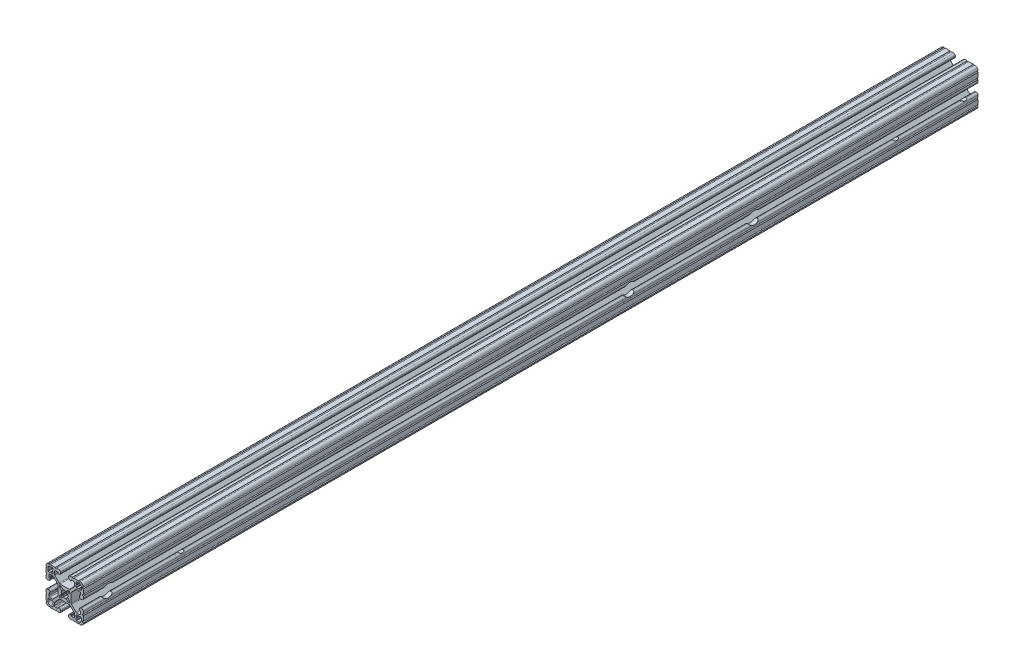
from build123d import *

# Parameters (mm, degrees)
BOSS_EXTRUDE1_DEPTH = 914.4
SKETCH3_R           = 4.7625
SKETCH3_R_2         = 6.35
CUT_EXTRUDE1_DEPTH  = 2323.966592157


with BuildPart() as part:
    # Sketch1 → Boss-Extrude1 (new body)
    with BuildSketch(Plane(origin=(0, 0, -2322.576), x_dir=(-1, 0, 0), z_dir=(0, 0, -1))):
        with BuildLine():
            Line((19.05, -14.325600033), (19.05, -9.4996))
            ThreePointArc((19.05, -9.4996), (18.288, -8.7376), (19.05, -7.9756))
            Line((19.05, -7.9756), (19.05, -5.6388))
            ThreePointArc((19.05, -5.6388), (18.588751759, -4.525248241), (17.4752, -4.064))
            Line((17.4752, -4.064), (16.5608, -4.064))
            ThreePointArc((16.5608, -4.064), (15.447248241, -4.525248241), (14.986, -5.6388))
            Line((14.986, -5.6388), (14.986, -6.350014224))
            ThreePointArc((14.986, -6.350014224), (15.097592316, -6.619421908), (15.367, -6.731014224))
            Line((15.367, -6.731014224), (15.6972, -6.731014224))
            ThreePointArc((15.6972, -6.731014224), (15.966607684, -6.84260654), (16.0782, -7.112014224))
            Line((16.0782, -7.112014224), (16.0782, -9.398014224))
            ThreePointArc((16.0782, -9.398014224), (15.817817928, -10.026632152), (15.1892, -10.287014224))
            Line((15.1892, -10.287014224), (12.375630013, -10.287014224))
            ThreePointArc((12.375630013, -10.287014224), (11.889622054, -10.19034123), (11.477604401, -9.915039836))
            Line((11.477604401, -9.915039836), (7.115699788, -5.553135223))
            ThreePointArc((7.115699788, -5.553135223), (6.840398394, -5.14111757), (6.7437254, -4.655109611))
            Line((6.7437254, -4.655109611), (6.7437254, 4.655109611))
            ThreePointArc((6.7437254, 4.655109611), (6.840398394, 5.14111757), (7.115699788, 5.553135223))
            Line((7.115699788, 5.553135223), (11.477604401, 9.915039836))
            ThreePointArc((11.477604401, 9.915039836), (11.889622054, 10.19034123), (12.375630013, 10.287014224))
            Line((12.375630013, 10.287014224), (15.1892, 10.287014224))
            ThreePointArc((15.1892, 10.287014224), (15.817817928, 10.026632152), (16.0782, 9.398014224))
            Line((16.0782, 9.398014224), (16.0782, 7.112014224))
            ThreePointArc((16.0782, 7.112014224), (15.966607684, 6.84260654), (15.6972, 6.731014224))
            Line((15.6972, 6.731014224), (15.367, 6.731014224))
            ThreePointArc((15.367, 6.731014224), (15.097592316, 6.619421908), (14.986, 6.350014224))
            Line((14.986, 6.350014224), (14.986, 5.6388))
            ThreePointArc((14.986, 5.6388), (15.447248241, 4.525248241), (16.5608, 4.064))
            Line((16.5608, 4.064), (17.4752, 4.064))
            ThreePointArc((17.4752, 4.064), (18.588751759, 4.525248241), (19.05, 5.6388))
            Line((19.05, 5.6388), (19.05, 7.9756))
            ThreePointArc((19.05, 7.9756), (18.288, 8.7376), (19.05, 9.4996))
            Line((19.05, 9.4996), (19.05, 14.325599984))
            ThreePointArc((19.05, 14.325599984), (18.287999986, 15.087549208), (19.049898416, 15.849600009))
            ThreePointArc((19.049898416, 15.849600009), (18.120064036, 18.120064058), (15.849599977, 19.049898414))
            ThreePointArc((15.849599977, 19.049898414), (15.0875492, 18.288000035), (14.325600017, 19.050000016))
            Line((14.325600017, 19.050000016), (9.499600001, 19.050000016))
            ThreePointArc((9.499600001, 19.050000016), (8.737600001, 18.288000016), (7.975600001, 19.050000016))
            Line((7.975600001, 19.050000016), (5.638800016, 19.050000016))
            ThreePointArc((5.638800016, 19.050000016), (4.525248257, 18.588751775), (4.064000016, 17.475200016))
            Line((4.064000016, 17.475200016), (4.064000016, 16.5608))
            ThreePointArc((4.064000016, 16.5608), (4.525248257, 15.447248241), (5.638800016, 14.986))
            Line((5.638800016, 14.986), (6.350014224, 14.986))
            ThreePointArc((6.350014224, 14.986), (6.619421908, 15.097592316), (6.731014224, 15.367))
            Line((6.731014224, 15.367), (6.731014224, 15.6972))
            ThreePointArc((6.731014224, 15.6972), (6.84260654, 15.966607684), (7.112014224, 16.0782))
            Line((7.112014224, 16.0782), (9.398014224, 16.0782))
            ThreePointArc((9.398014224, 16.0782), (10.026632152, 15.817817928), (10.287014224, 15.1892))
            Line((10.287014224, 15.1892), (10.287014224, 12.375630013))
            ThreePointArc((10.287014224, 12.375630013), (10.19034123, 11.889622054), (9.915039836, 11.477604401))
            Line((9.915039836, 11.477604401), (5.553135223, 7.115699788))
            ThreePointArc((5.553135223, 7.115699788), (5.14111757, 6.840398394), (4.655109611, 6.7437254))
            Line((4.655109611, 6.7437254), (-4.655109611, 6.7437254))
            ThreePointArc((-4.655109611, 6.7437254), (-5.14111757, 6.840398394), (-5.553135223, 7.115699788))
            Line((-5.553135223, 7.115699788), (-9.915039836, 11.477604401))
            ThreePointArc((-9.915039836, 11.477604401), (-10.19034123, 11.889622054), (-10.287014224, 12.375630013))
            Line((-10.287014224, 12.375630013), (-10.287014224, 15.1892))
            ThreePointArc((-10.287014224, 15.1892), (-10.026632152, 15.817817928), (-9.398014224, 16.0782))
            Line((-9.398014224, 16.0782), (-7.112014224, 16.0782))
            ThreePointArc((-7.112014224, 16.0782), (-6.84260654, 15.966607684), (-6.731014224, 15.6972))
            Line((-6.731014224, 15.6972), (-6.731014224, 15.367))
            ThreePointArc((-6.731014224, 15.367), (-6.619421908, 15.097592316), (-6.350014224, 14.986))
            Line((-6.350014224, 14.986), (-5.638799984, 14.986))
            ThreePointArc((-5.638799984, 14.986), (-4.525248225, 15.447248241), (-4.063999984, 16.5608))
            Line((-4.063999984, 16.5608), (-4.063999984, 17.475200016))
            ThreePointArc((-4.063999984, 17.475200016), (-4.525248225, 18.588751775), (-5.638799984, 19.050000016))
            Line((-5.638799984, 19.050000016), (-7.975599999, 19.050000016))
            ThreePointArc((-7.975599999, 19.050000016), (-8.737599999, 18.288000016), (-9.499599999, 19.050000016))
            Line((-9.499599999, 19.050000016), (-14.325599999, 19.050000016))
            ThreePointArc((-14.325599999, 19.050000016), (-15.087549199, 18.288000018), (-15.849599993, 19.049898416))
            ThreePointArc((-15.849599993, 19.049898416), (-18.120064042, 18.120064036), (-19.049898398, 15.849599976))
            ThreePointArc((-19.049898398, 15.849599976), (-18.288000019, 15.087549199), (-19.05, 14.325600017))
            Line((-19.05, 14.325600017), (-19.05, 9.4996))
            ThreePointArc((-19.05, 9.4996), (-18.288, 8.7376), (-19.05, 7.9756))
            Line((-19.05, 7.9756), (-19.05, 5.6388))
            ThreePointArc((-19.05, 5.6388), (-18.588751759, 4.525248241), (-17.4752, 4.064))
            Line((-17.4752, 4.064), (-16.5608, 4.064))
            ThreePointArc((-16.5608, 4.064), (-15.447248241, 4.525248241), (-14.986, 5.6388))
            Line((-14.986, 5.6388), (-14.986, 6.350014224))
            ThreePointArc((-14.986, 6.350014224), (-15.097592316, 6.619421908), (-15.367, 6.731014224))
            Line((-15.367, 6.731014224), (-15.6972, 6.731014224))
            ThreePointArc((-15.6972, 6.731014224), (-15.966607684, 6.84260654), (-16.0782, 7.112014224))
            Line((-16.0782, 7.112014224), (-16.0782, 9.398014224))
            ThreePointArc((-16.0782, 9.398014224), (-15.817817928, 10.026632152), (-15.1892, 10.287014224))
            Line((-15.1892, 10.287014224), (-12.375630013, 10.287014224))
            ThreePointArc((-12.375630013, 10.287014224), (-11.889622054, 10.19034123), (-11.477604401, 9.915039836))
            Line((-11.477604401, 9.915039836), (-7.115699788, 5.553135223))
            ThreePointArc((-7.115699788, 5.553135223), (-6.840398394, 5.14111757), (-6.7437254, 4.655109611))
            Line((-6.7437254, 4.655109611), (-6.7437254, -4.655109611))
            ThreePointArc((-6.7437254, -4.655109611), (-6.840398394, -5.14111757), (-7.115699788, -5.553135223))
            Line((-7.115699788, -5.553135223), (-11.477604401, -9.915039836))
            ThreePointArc((-11.477604401, -9.915039836), (-11.889622054, -10.19034123), (-12.375630013, -10.287014224))
            Line((-12.375630013, -10.287014224), (-15.1892, -10.287014224))
            ThreePointArc((-15.1892, -10.287014224), (-15.817817928, -10.026632152), (-16.0782, -9.398014224))
            Line((-16.0782, -9.398014224), (-16.0782, -7.112014224))
            ThreePointArc((-16.0782, -7.112014224), (-15.966607684, -6.84260654), (-15.6972, -6.731014224))
            Line((-15.6972, -6.731014224), (-15.367, -6.731014224))
            ThreePointArc((-15.367, -6.731014224), (-15.097592316, -6.619421908), (-14.986, -6.350014224))
            Line((-14.986, -6.350014224), (-14.986, -5.6388))
            ThreePointArc((-14.986, -5.6388), (-15.447248241, -4.525248241), (-16.5608, -4.064))
            Line((-16.5608, -4.064), (-17.4752, -4.064))
            ThreePointArc((-17.4752, -4.064), (-18.588751759, -4.525248241), (-19.05, -5.6388))
            Line((-19.05, -5.6388), (-19.05, -7.9756))
            ThreePointArc((-19.05, -7.9756), (-18.288, -8.7376), (-19.05, -9.4996))
            Line((-19.05, -9.4996), (-19.05, -14.3256))
            ThreePointArc((-19.05, -14.3256), (-18.288000002, -15.0875492), (-19.0498984, -15.849599993))
            ThreePointArc((-19.0498984, -15.849599993), (-18.120064019, -18.120064043), (-15.84959996, -19.049898399))
            ThreePointArc((-15.84959996, -19.049898399), (-15.087549183, -18.288000019), (-14.325600001, -19.050000001))
            Line((-14.325600001, -19.050000001), (-9.499599984, -19.050000001))
            ThreePointArc((-9.499599984, -19.050000001), (-8.737599984, -18.288000001), (-7.975599984, -19.050000001))
            Line((-7.975599984, -19.050000001), (-5.638799984, -19.050000001))
            ThreePointArc((-5.638799984, -19.050000001), (-4.525248225, -18.58875176), (-4.063999984, -17.475200001))
            Line((-4.063999984, -17.475200001), (-4.063999984, -16.5608))
            ThreePointArc((-4.063999984, -16.5608), (-4.525248225, -15.447248241), (-5.638799984, -14.986))
            Line((-5.638799984, -14.986), (-6.350014224, -14.986))
            ThreePointArc((-6.350014224, -14.986), (-6.619421908, -15.097592316), (-6.731014224, -15.367))
            Line((-6.731014224, -15.367), (-6.731014224, -15.6972))
            ThreePointArc((-6.731014224, -15.6972), (-6.84260654, -15.966607684), (-7.112014224, -16.0782))
            Line((-7.112014224, -16.0782), (-9.398014224, -16.0782))
            ThreePointArc((-9.398014224, -16.0782), (-10.026632152, -15.817817928), (-10.287014224, -15.1892))
            Line((-10.287014224, -15.1892), (-10.287014224, -12.375630013))
            ThreePointArc((-10.287014224, -12.375630013), (-10.19034123, -11.889622054), (-9.915039836, -11.477604401))
            Line((-9.915039836, -11.477604401), (-5.553135223, -7.115699788))
            ThreePointArc((-5.553135223, -7.115699788), (-5.14111757, -6.840398394), (-4.655109611, -6.7437254))
            Line((-4.655109611, -6.7437254), (4.655109611, -6.7437254))
            ThreePointArc((4.655109611, -6.7437254), (5.14111757, -6.840398394), (5.553135223, -7.115699788))
            Line((5.553135223, -7.115699788), (9.915039836, -11.477604401))
            ThreePointArc((9.915039836, -11.477604401), (10.19034123, -11.889622054), (10.287014224, -12.375630013))
            Line((10.287014224, -12.375630013), (10.287014224, -15.1892))
            ThreePointArc((10.287014224, -15.1892), (10.026632152, -15.817817928), (9.398014224, -16.0782))
            Line((9.398014224, -16.0782), (7.112014224, -16.0782))
            ThreePointArc((7.112014224, -16.0782), (6.84260654, -15.966607684), (6.731014224, -15.6972))
            Line((6.731014224, -15.6972), (6.731014224, -15.367))
            ThreePointArc((6.731014224, -15.367), (6.619421908, -15.097592316), (6.350014224, -14.986))
            Line((6.350014224, -14.986), (5.638800016, -14.986))
            ThreePointArc((5.638800016, -14.986), (4.525248257, -15.447248241), (4.064000016, -16.5608))
            Line((4.064000016, -16.5608), (4.064000016, -17.475200001))
            ThreePointArc((4.064000016, -17.475200001), (4.525248257, -18.58875176), (5.638800016, -19.050000001))
            Line((5.638800016, -19.050000001), (7.975600016, -19.050000001))
            ThreePointArc((7.975600016, -19.050000001), (8.737600016, -18.288000001), (9.499600016, -19.050000001))
            Line((9.499600016, -19.050000001), (14.325600016, -19.050000001))
            ThreePointArc((14.325600016, -19.050000001), (15.087549216, -18.288000002), (15.849600009, -19.0498984))
            ThreePointArc((15.849600009, -19.0498984), (18.120064059, -18.12006402), (19.049898415, -15.849599961))
            ThreePointArc((19.049898415, -15.849599961), (18.288000034, -15.087549207), (19.05, -14.325600033))
        make_face()
        with BuildLine():
            Line((17.246614224, 14.452614224), (17.246614224, 12.242814224))
            ThreePointArc((17.246614224, 12.242814224), (17.135021908, 11.97340654), (16.865614224, 11.861814224))
            Line((16.865614224, 11.861814224), (15.092694224, 11.861814224))
            Line((15.092694224, 11.861814224), (14.554214224, 12.400294224))
            Line((14.554214224, 12.400294224), (14.015734224, 11.861814224))
            Line((14.015734224, 11.861814224), (12.242814224, 11.861814224))
            ThreePointArc((12.242814224, 11.861814224), (11.97340654, 11.97340654), (11.861814224, 12.242814224))
            Line((11.861814224, 12.242814224), (11.861814224, 14.015734224))
            Line((11.861814224, 14.015734224), (12.400294224, 14.554214224))
            Line((12.400294224, 14.554214224), (11.861814224, 15.092694224))
            Line((11.861814224, 15.092694224), (11.861814224, 16.865614224))
            ThreePointArc((11.861814224, 16.865614224), (11.97340654, 17.135021908), (12.242814224, 17.246614224))
            Line((12.242814224, 17.246614224), (14.452614224, 17.246614224))
            ThreePointArc((14.452614224, 17.246614224), (16.428270571, 16.428270571), (17.246614224, 14.452614224))
        make_face(mode=Mode.SUBTRACT)
        with BuildLine():
            Line((17.246614224, -12.242814224), (17.246614224, -14.452614224))
            ThreePointArc((17.246614224, -14.452614224), (16.428270571, -16.428270571), (14.452614224, -17.246614224))
            Line((14.452614224, -17.246614224), (12.242814224, -17.246614224))
            ThreePointArc((12.242814224, -17.246614224), (11.97340654, -17.135021908), (11.861814224, -16.865614224))
            Line((11.861814224, -16.865614224), (11.861814224, -15.092694224))
            Line((11.861814224, -15.092694224), (12.400294224, -14.554214224))
            Line((12.400294224, -14.554214224), (11.861814224, -14.015734224))
            Line((11.861814224, -14.015734224), (11.861814224, -12.242814224))
            ThreePointArc((11.861814224, -12.242814224), (11.97340654, -11.97340654), (12.242814224, -11.861814224))
            Line((12.242814224, -11.861814224), (14.015734224, -11.861814224))
            Line((14.015734224, -11.861814224), (14.554214224, -12.400294224))
            Line((14.554214224, -12.400294224), (15.092694224, -11.861814224))
            Line((15.092694224, -11.861814224), (16.865614224, -11.861814224))
            ThreePointArc((16.865614224, -11.861814224), (17.135021908, -11.97340654), (17.246614224, -12.242814224))
        make_face(mode=Mode.SUBTRACT)
        with BuildLine():
            Line((5.1689, -3.920689755), (5.1689, -4.9149))
            ThreePointArc((5.1689, -4.9149), (5.094505122, -5.094505122), (4.9149, -5.1689))
            Line((4.9149, -5.1689), (3.920689755, -5.1689))
            ThreePointArc((3.920689755, -5.1689), (3.580484184, -5.101228904), (3.292071827, -4.908517928))
            Line((3.292071827, -4.908517928), (1.582347442, -3.198793543))
            ThreePointArc((1.582347442, -3.198793543), (1.393016011, -3.095711236), (1.178048687, -3.111879183))
            ThreePointArc((1.178048687, -3.111879183), (0, -3.3274), (-1.178048687, -3.111879183))
            ThreePointArc((-1.178048687, -3.111879183), (-1.393016011, -3.095711236), (-1.582347442, -3.198793543))
            Line((-1.582347442, -3.198793543), (-3.292071827, -4.908517928))
            ThreePointArc((-3.292071827, -4.908517928), (-3.580484184, -5.101228904), (-3.920689755, -5.1689))
            Line((-3.920689755, -5.1689), (-4.9149, -5.1689))
            ThreePointArc((-4.9149, -5.1689), (-5.094505122, -5.094505122), (-5.1689, -4.9149))
            Line((-5.1689, -4.9149), (-5.1689, -3.920689755))
            ThreePointArc((-5.1689, -3.920689755), (-5.101228904, -3.580484184), (-4.908517928, -3.292071827))
            Line((-4.908517928, -3.292071827), (-3.198793543, -1.582347442))
            ThreePointArc((-3.198793543, -1.582347442), (-3.095711236, -1.393016011), (-3.111879183, -1.178048687))
            ThreePointArc((-3.111879183, -1.178048687), (-3.3274, 0), (-3.111879183, 1.178048687))
            ThreePointArc((-3.111879183, 1.178048687), (-3.095711236, 1.393016011), (-3.198793543, 1.582347442))
            Line((-3.198793543, 1.582347442), (-4.908517928, 3.292071827))
            ThreePointArc((-4.908517928, 3.292071827), (-5.101228904, 3.580484184), (-5.1689, 3.920689755))
            Line((-5.1689, 3.920689755), (-5.1689, 4.9149))
            ThreePointArc((-5.1689, 4.9149), (-5.094505122, 5.094505122), (-4.9149, 5.1689))
            Line((-4.9149, 5.1689), (-3.920689755, 5.1689))
            ThreePointArc((-3.920689755, 5.1689), (-3.580484184, 5.101228904), (-3.292071827, 4.908517928))
            Line((-3.292071827, 4.908517928), (-1.582347442, 3.198793543))
            ThreePointArc((-1.582347442, 3.198793543), (-1.393016011, 3.095711236), (-1.178048687, 3.111879183))
            ThreePointArc((-1.178048687, 3.111879183), (0, 3.3274), (1.178048687, 3.111879183))
            ThreePointArc((1.178048687, 3.111879183), (1.393016011, 3.095711236), (1.582347442, 3.198793543))
            Line((1.582347442, 3.198793543), (3.292071827, 4.908517928))
            ThreePointArc((3.292071827, 4.908517928), (3.580484184, 5.101228904), (3.920689755, 5.1689))
            Line((3.920689755, 5.1689), (4.9149, 5.1689))
            ThreePointArc((4.9149, 5.1689), (5.094505122, 5.094505122), (5.1689, 4.9149))
            Line((5.1689, 4.9149), (5.1689, 3.920689755))
            ThreePointArc((5.1689, 3.920689755), (5.101228904, 3.580484184), (4.908517928, 3.292071827))
            Line((4.908517928, 3.292071827), (3.198793543, 1.582347442))
            ThreePointArc((3.198793543, 1.582347442), (3.095711236, 1.393016011), (3.111879183, 1.178048687))
            ThreePointArc((3.111879183, 1.178048687), (3.3274, 0), (3.111879183, -1.178048687))
            ThreePointArc((3.111879183, -1.178048687), (3.095711236, -1.393016011), (3.198793543, -1.582347442))
            Line((3.198793543, -1.582347442), (4.908517928, -3.292071827))
            ThreePointArc((4.908517928, -3.292071827), (5.101228904, -3.580484184), (5.1689, -3.920689755))
        make_face(mode=Mode.SUBTRACT)
        with BuildLine():
            Line((-11.861814224, -12.242814224), (-11.861814224, -14.015734224))
            Line((-11.861814224, -14.015734224), (-12.400294224, -14.554214224))
            Line((-12.400294224, -14.554214224), (-11.861814224, -15.092694224))
            Line((-11.861814224, -15.092694224), (-11.861814224, -16.865614224))
            ThreePointArc((-11.861814224, -16.865614224), (-11.97340654, -17.135021908), (-12.242814224, -17.246614224))
            Line((-12.242814224, -17.246614224), (-14.452614224, -17.246614224))
            ThreePointArc((-14.452614224, -17.246614224), (-16.428270571, -16.428270571), (-17.246614224, -14.452614224))
            Line((-17.246614224, -14.452614224), (-17.246614224, -12.242814224))
            ThreePointArc((-17.246614224, -12.242814224), (-17.135021908, -11.97340654), (-16.865614224, -11.861814224))
            Line((-16.865614224, -11.861814224), (-15.092694224, -11.861814224))
            Line((-15.092694224, -11.861814224), (-14.554214224, -12.400294224))
            Line((-14.554214224, -12.400294224), (-14.015734224, -11.861814224))
            Line((-14.015734224, -11.861814224), (-12.242814224, -11.861814224))
            ThreePointArc((-12.242814224, -11.861814224), (-11.97340654, -11.97340654), (-11.861814224, -12.242814224))
        make_face(mode=Mode.SUBTRACT)
        with BuildLine():
            Line((-11.861814224, 16.865614224), (-11.861814224, 15.092694224))
            Line((-11.861814224, 15.092694224), (-12.400294224, 14.554214224))
            Line((-12.400294224, 14.554214224), (-11.861814224, 14.015734224))
            Line((-11.861814224, 14.015734224), (-11.861814224, 12.242814224))
            ThreePointArc((-11.861814224, 12.242814224), (-11.97340654, 11.97340654), (-12.242814224, 11.861814224))
            Line((-12.242814224, 11.861814224), (-14.015734224, 11.861814224))
            Line((-14.015734224, 11.861814224), (-14.554214224, 12.400294224))
            Line((-14.554214224, 12.400294224), (-15.092694224, 11.861814224))
            Line((-15.092694224, 11.861814224), (-16.865614224, 11.861814224))
            ThreePointArc((-16.865614224, 11.861814224), (-17.135021908, 11.97340654), (-17.246614224, 12.242814224))
            Line((-17.246614224, 12.242814224), (-17.246614224, 14.452614224))
            ThreePointArc((-17.246614224, 14.452614224), (-16.428270571, 16.428270571), (-14.452614224, 17.246614224))
            Line((-14.452614224, 17.246614224), (-12.242814224, 17.246614224))
            ThreePointArc((-12.242814224, 17.246614224), (-11.97340654, 17.135021908), (-11.861814224, 16.865614224))
        make_face(mode=Mode.SUBTRACT)
    extrude(amount=-BOSS_EXTRUDE1_DEPTH)

    # Sketch3 → Cut-Extrude1 (cut, through all)
    with BuildSketch(Plane(origin=(19.05, 0, 0), x_dir=(0, 0, -1), z_dir=(1, 0, 0))):
        with Locations((2309.876, 0)):
            Circle(SKETCH3_R)
        with Locations((2240.026, 0)):
            Circle(SKETCH3_R)
        with Locations((2093.976, 0)):
            Circle(SKETCH3_R_2)
        with Locations((1966.976, 0)):
            Circle(SKETCH3_R_2)
        with Locations((1433.576, 0)):
            Circle(SKETCH3_R_2)
        with Locations((1509.776, 0)):
            Circle(SKETCH3_R)
    extrude(amount=-CUT_EXTRUDE1_DEPTH, mode=Mode.SUBTRACT)


solid = part.part
